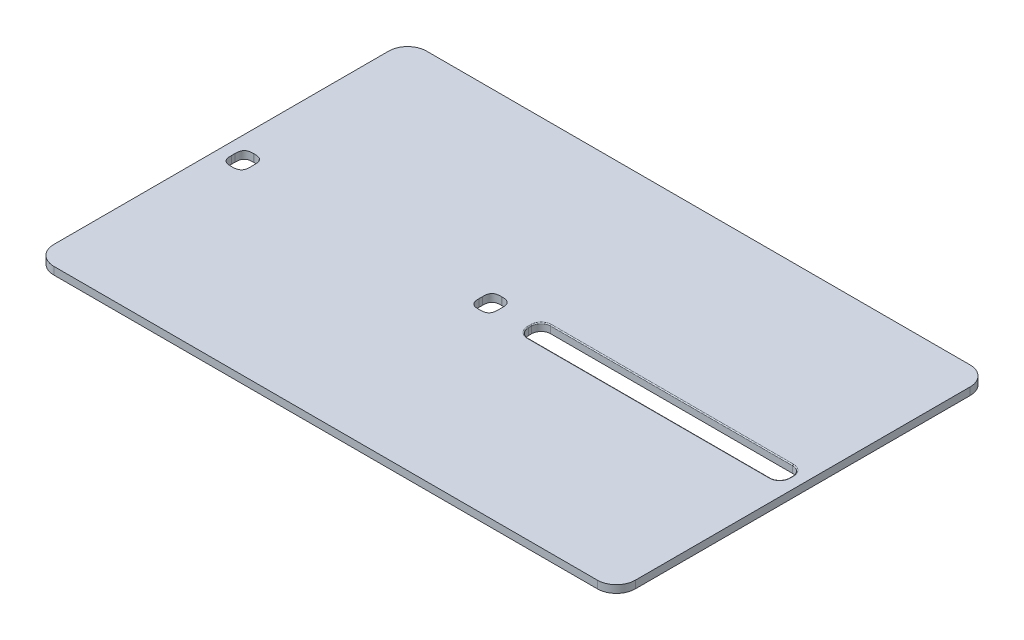
from build123d import *

# Parameters (mm, degrees)
SKETCH1_W                   = 78
SKETCH1_H                   = 50
STEEL_FACE_DEPTH            = 1.016
CARD_EDGES_R                = 2.54
SKETCH2_R                   = 2.54
MAGNET_CAVITY_DEPTH         = 0.333375
MIRROR2_COPY_1_SKETCH_R     = 2.54
MIRROR2_COPY_1_DEPTH        = 0.333375
SKETCH3_R                   = 10.049999966
BATTERY_POCKETS_DEPTH       = 0.873000032
SKETCH5_W                   = 35.000000104
SKETCH5_H                   = 3.000000096
LED_SLOT_DEPTH              = 93.655449144
LED_SLOT_CORNER_ROUND_R     = 1.27
LED_SLOT_SURFACE_ROUND_R    = 0.127
SKETCH6_W                   = 2.59999988
SKETCH6_H                   = 3.000000096
ALS_DATA_SENSOR_SLOT_DEPTH  = 93.655449144
SKETCH8_W                   = 2.59999988
SKETCH8_H                   = 3.000000096
ALS_CLOCK_SENSOR_SLOT_DEPTH = 93.655449144
FILLET4_SIZE                = 1.27


with BuildPart() as part:
    # Sketch1 → steel_face (new body)
    with BuildSketch(Plane(origin=(0, 0, 0), x_dir=(1, 0, 0), z_dir=(0, 1, 0))):
        with Locations((39, 25)):
            Rectangle(SKETCH1_W, SKETCH1_H)
    extrude(amount=STEEL_FACE_DEPTH)

    # card_edges
    card_edges_edges = [part.edges().sort_by_distance(p)[0] for p in [
        (0, 0.508, -50),
        (78, 0.508, -50),
        (78, 0.508, 0),
        (0, 0.508, 0),
    ]]
    fillet(card_edges_edges, radius=CARD_EDGES_R)

    # Sketch2 → magnet_cavity (cut)
    with BuildSketch(Plane.XZ):
        with Locations(Location((4.1275, -45.8725, 0), (0, 0, 270))):
            Circle(SKETCH2_R)
    magnet_cavity = extrude(amount=-MAGNET_CAVITY_DEPTH, mode=Mode.SUBTRACT)

    # Mirror1: magnet_cavity across plane
    add(magnet_cavity.mirror(Plane.XY.offset(-25.000000038)), mode=Mode.SUBTRACT)

    # Mirror2: magnet_cavity across plane
    add(magnet_cavity.mirror(Plane(origin=(38.999999978, 0, 0), x_dir=(0, 0, 1), z_dir=(1, 0, 0))), mode=Mode.SUBTRACT)

    # Mirror2 copy 1 sketch → Mirror2 copy 1 (cut)
    with BuildSketch(Plane(origin=(77.999999956, 0, -50.000000076), x_dir=(-1, 0, 0), z_dir=(0, -1, 0))):
        with Locations(Location((4.1275, -45.8725, 0), (0, 0, 270))):
            Circle(MIRROR2_COPY_1_SKETCH_R)
    extrude(amount=-MIRROR2_COPY_1_DEPTH, mode=Mode.SUBTRACT)

    # Sketch3 → battery_pockets (cut)
    with BuildSketch(Plane.XZ):
        with Locations(Location((16.399999966, -11.637499966, 0), (0, 0, 270))):
            Circle(SKETCH3_R)
        with Locations(Location((16.399999966, -38.362500034, 0), (0, 0, 270))):
            Circle(SKETCH3_R)
    extrude(amount=-BATTERY_POCKETS_DEPTH, mode=Mode.SUBTRACT)

    # Sketch5 → led_slot (cut, through all)
    with BuildSketch(Plane(origin=(0, 0, 0), x_dir=(1, 0, 0), z_dir=(0, 1, 0))):
        with Locations((58.912499948, 25.000000038)):
            Rectangle(SKETCH5_W, SKETCH5_H)
    extrude(amount=LED_SLOT_DEPTH, mode=Mode.SUBTRACT)

    # led_slot_corner_round
    led_slot_corner_round_edges = [part.edges().sort_by_distance(p)[0] for p in [
        (76.4125, 0.508, -23.49999999),
        (76.4125, 0.508, -26.500000086),
        (41.412499896, 0.508, -26.500000086),
        (41.412499896, 0.508, -23.49999999),
    ]]
    fillet(led_slot_corner_round_edges, radius=LED_SLOT_CORNER_ROUND_R)

    # led_slot_surface_round
    led_slot_surface_round_edges = [part.edges().sort_by_distance(p)[0] for p in [
        (58.912499948, 1.016, -26.500000086),
        (41.412499896, 1.016, -25.000000038),
        (58.912499948, 1.016, -23.49999999),
        (76.4125, 1.016, -25.000000038),
        (41.784474284, 1.016, -26.128025698),
        (41.784474284, 1.016, -23.871974378),
        (76.040525612, 1.016, -26.128025698),
        (76.040525612, 1.016, -23.871974378),
    ]]
    fillet(led_slot_surface_round_edges, radius=LED_SLOT_SURFACE_ROUND_R)

    # Sketch6 → als_data_sensor_slot (cut, through all)
    with BuildSketch(Plane.XZ):
        with Locations((2.88749994, -25.000000038)):
            Rectangle(SKETCH6_W, SKETCH6_H)
    extrude(amount=-ALS_DATA_SENSOR_SLOT_DEPTH, mode=Mode.SUBTRACT)

    # Sketch8 → als_clock_sensor_slot (cut, through all)
    with BuildSketch(Plane.XZ):
        with Locations((36.112500038, -25.000000038)):
            Rectangle(SKETCH8_W, SKETCH8_H)
    extrude(amount=-ALS_CLOCK_SENSOR_SLOT_DEPTH, mode=Mode.SUBTRACT)

    # Fillet4
    # a fillet whose section is not a circle: 1.27 mm, written as the material it adds along each edge
    with BuildSketch(Plane(origin=(1.5875, 0, -26.500000086), x_dir=(0, 0, 1), z_dir=(0, 1, 0)), Plane(origin=(1.5875, 0, -23.49999999), x_dir=(1, 0, 0), z_dir=(0, 1, 0)), Plane(origin=(34.812500098, 0, -23.49999999), x_dir=(1, 0, 0), z_dir=(0, 1, 0))) as fillet4_piece_1:
        with BuildLine():
            add(Edge.make_bspline([(FILLET4_SIZE, 0), (FILLET4_SIZE * 0.831801948466, 0), (FILLET4_SIZE * 0.663603896932, 0), (FILLET4_SIZE * 0.292893218813, FILLET4_SIZE * 0.0716919198361), (FILLET4_SIZE * 0.0716919198361, FILLET4_SIZE * 0.292893218813), (0, FILLET4_SIZE * 0.663603896932), (0, FILLET4_SIZE * 0.831801948466), (0, FILLET4_SIZE)], knots=[0, 0, 0, 0, 0, 0, 0.5, 0.5, 1, 1, 1, 1, 1, 1], degree=5))
            Line((0, FILLET4_SIZE), (-FILLET4_SIZE * 0.02, FILLET4_SIZE))
            Line((-FILLET4_SIZE * 0.02, FILLET4_SIZE), (-FILLET4_SIZE * 0.02, -FILLET4_SIZE * 0.02))
            Line((-FILLET4_SIZE * 0.02, -FILLET4_SIZE * 0.02), (FILLET4_SIZE, -FILLET4_SIZE * 0.02))
            Line((FILLET4_SIZE, -FILLET4_SIZE * 0.02), (FILLET4_SIZE, 0))
        make_face()
    extrude(amount=1.016)
    with BuildSketch(Plane(origin=(4.18749988, 0, -26.500000086), x_dir=(0, 0, 1), z_dir=(0, 1, 0)), Plane(origin=(4.18749988, 0, -23.49999999), x_dir=(-1, 0, 0), z_dir=(0, 1, 0)), Plane(origin=(34.812500098, 0, -26.500000086), x_dir=(1, 0, 0), z_dir=(0, 1, 0)), Plane(origin=(37.412499978, 0, -26.500000086), x_dir=(0, 0, 1), z_dir=(0, 1, 0)), Plane(origin=(37.412499978, 0, -23.49999999), x_dir=(-1, 0, 0), z_dir=(0, 1, 0))) as fillet4_piece_2:
        with BuildLine():
            add(Edge.make_bspline([(FILLET4_SIZE, 0), (FILLET4_SIZE * 0.831801948466, 0), (FILLET4_SIZE * 0.663603896932, 0), (FILLET4_SIZE * 0.292893218813, -FILLET4_SIZE * 0.0716919198361), (FILLET4_SIZE * 0.0716919198361, -FILLET4_SIZE * 0.292893218813), (0, -FILLET4_SIZE * 0.663603896932), (0, -FILLET4_SIZE * 0.831801948466), (0, -FILLET4_SIZE)], knots=[0, 0, 0, 0, 0, 0, 0.5, 0.5, 1, 1, 1, 1, 1, 1], degree=5))
            Line((0, -FILLET4_SIZE), (-FILLET4_SIZE * 0.02, -FILLET4_SIZE))
            Line((-FILLET4_SIZE * 0.02, -FILLET4_SIZE), (-FILLET4_SIZE * 0.02, FILLET4_SIZE * 0.02))
            Line((-FILLET4_SIZE * 0.02, FILLET4_SIZE * 0.02), (FILLET4_SIZE, FILLET4_SIZE * 0.02))
            Line((FILLET4_SIZE, FILLET4_SIZE * 0.02), (FILLET4_SIZE, 0))
        make_face()
    extrude(amount=1.016)


solid = part.part
